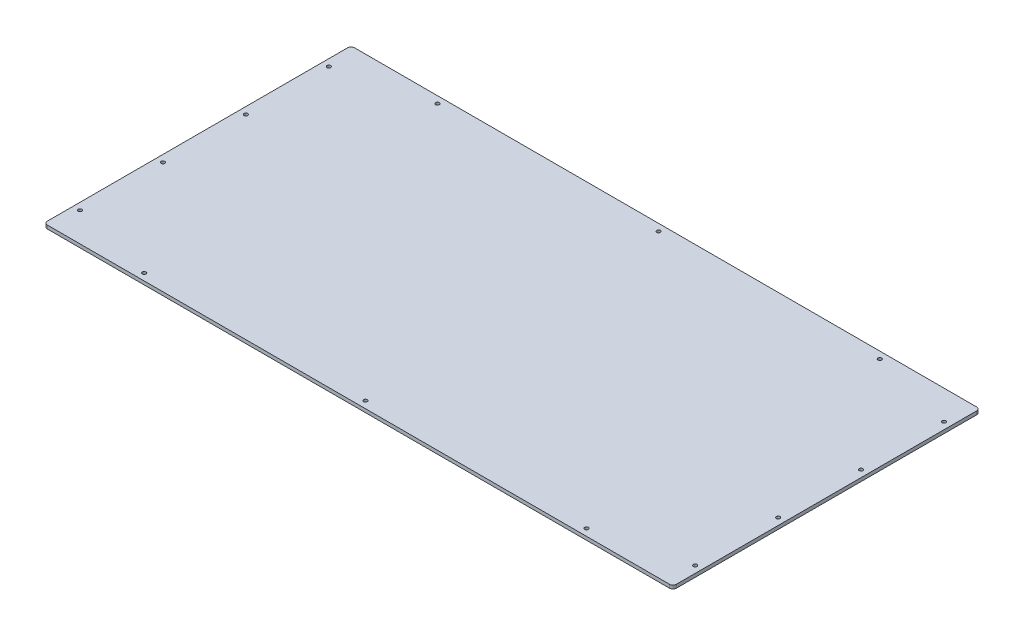
from build123d import *

# Parameters (mm, degrees)
SKETCH1_W                        = 1155.7
SKETCH1_H                        = 564.26608
BOSS_EXTRUDE1_DEPTH              = 6.35
FILLET1_R                        = 6.35
F_17_64_0_26563_DIAMETER_HOLE1_D = 6.747002


with BuildPart() as part:
    # Sketch1 → Boss-Extrude1 (new body)
    with BuildSketch(Plane(origin=(0, 0, 0), x_dir=(1, 0, 0), z_dir=(0, 1, 0))):
        Rectangle(SKETCH1_W, SKETCH1_H)
    extrude(amount=BOSS_EXTRUDE1_DEPTH)

    # Fillet1
    fillet1_edges = [part.edges().sort_by_distance(p)[0] for p in [
        (577.85, 3.175, 282.13304),
        (577.85, 3.175, -282.13304),
        (-577.85, 3.175, 282.13304),
        (-577.85, 3.175, -282.13304),
    ]]
    fillet(fillet1_edges, radius=FILLET1_R)

    # 17/64 (0.26563) Diameter Hole1 (through all)
    with Locations(Plane(origin=(0, 6.35, 0), x_dir=(1, 0, 0), z_dir=(0, 1, 0))):
        with Locations((-565.15, 228.6), (-565.15, 76.2), (-565.15, -76.2), (-565.15, -228.6), (565.15, 228.6), (565.15, 76.2), (565.15, -76.2), (565.15, -228.6), (-406.4, 269.43304), (0, 269.43304), (406.4, 269.43304), (406.4, -269.43304), (0, -269.43304), (-406.4, -269.43304)):
            Hole(F_17_64_0_26563_DIAMETER_HOLE1_D / 2)


solid = part.part
